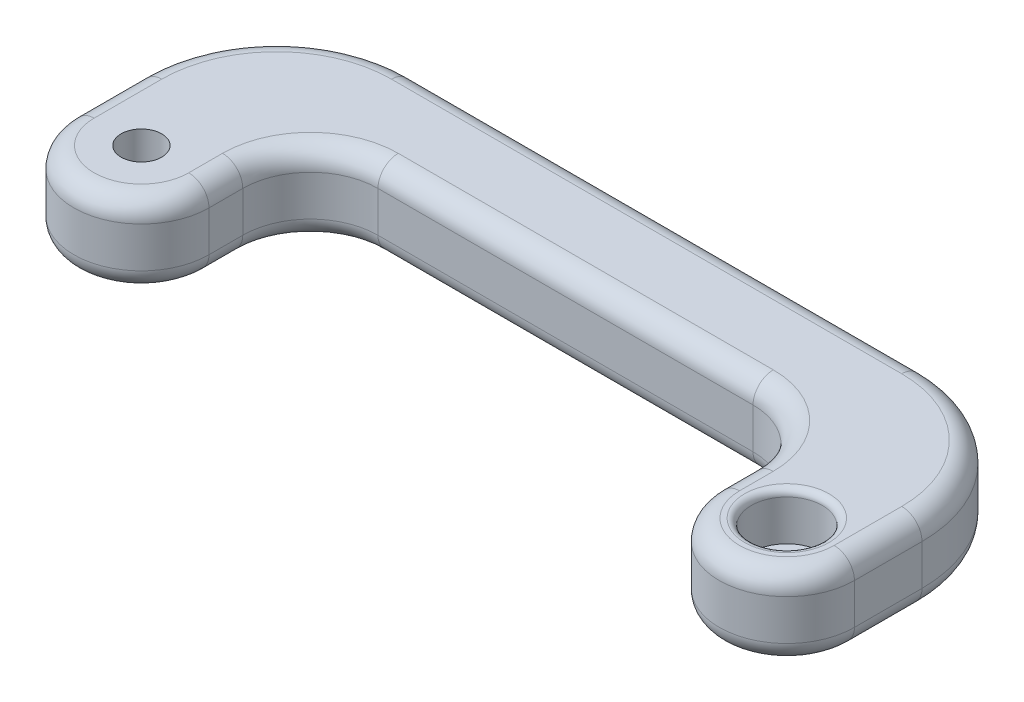
from build123d import *

# Parameters (mm, degrees)
SKETCH7_R           = 5
BOSS_EXTRUDE5_DEPTH = 12
FILLET2_R           = 20
FILLET3_R           = 10
FILLET5_R           = 3
SKETCH11_R          = 5.25
CUT_EXTRUDE1_DEPTH  = 36
FILLET6_R           = 1
SKETCH12_R          = 6.25
SKETCH12_R_2        = 3
BOSS_EXTRUDE6_DEPTH = 5
SKETCH13_R          = 6.25
SKETCH13_R_2        = 3
BOSS_EXTRUDE7_DEPTH = 5


with BuildPart() as part:
    # Sketch7 → Boss-Extrude5 (new body)
    with BuildSketch(Plane(origin=(0, 0, 0), x_dir=(1, 0, 0), z_dir=(0, 1, 0))):
        with BuildLine():
            Line((-105.5, 30), (-105.5, 0))
            ThreePointArc((-105.5, 0), (-95.5, -10), (-85.5, 0))
            Line((-85.5, 0), (-85.5, 15))
            Line((-85.5, 15), (-10, 15))
            Line((-10, 15), (-10, 0))
            ThreePointArc((-10, 0), (0, -10), (10, 0))
            Line((10, 0), (10, 30))
            Line((10, 30), (-10, 30))
            Line((-10, 30), (-85.5, 30))
            Line((-85.5, 30), (-105.5, 30))
        make_face()
        with Locations((-95.5, 0)):
            Circle(SKETCH7_R, mode=Mode.SUBTRACT)
    extrude(amount=BOSS_EXTRUDE5_DEPTH)

    # Fillet2
    fillet2_edges = [part.edges().sort_by_distance(p)[0] for p in [
        (10, 6, -30),
        (-105.5, 6, -30),
    ]]
    fillet(fillet2_edges, radius=FILLET2_R)

    # Fillet3
    fillet3_edges = [part.edges().sort_by_distance(p)[0] for p in [
        (-10, 6, -15),
        (-85.5, 6, -15),
    ]]
    fillet(fillet3_edges, radius=FILLET3_R)

    # Fillet5
    fillet5_edges = [part.edges().sort_by_distance(p)[0] for p in [
        (-47.75, 12, -30),
        (4.142135624, 12, -24.142135624),
        (10, 12, -5),
        (0, 12, 10),
        (-10, 12, -2.5),
        (-12.928932188, 12, -12.071067812),
        (-47.75, 12, -15),
        (-82.571067812, 12, -12.071067812),
        (-85.5, 12, -2.5),
        (-95.5, 12, 10),
        (-105.5, 12, -5),
        (-105.5, 0, -5),
        (-95.5, 0, 10),
        (-85.5, 0, -2.5),
        (-82.571067812, 0, -12.071067812),
        (-47.75, 0, -15),
        (-12.928932188, 0, -12.071067812),
        (-10, 0, -2.5),
        (0, 0, 10),
        (10, 0, -5),
        (4.142135624, 0, -24.142135624),
        (-47.75, 0, -30),
        (-99.642135624, 12, -24.142135624),
        (-99.642135624, 0, -24.142135624),
    ]]
    fillet(fillet5_edges, radius=FILLET5_R)

    # Sketch11 → Cut-Extrude1 (cut)
    with BuildSketch(Plane.XZ):
        with Locations((-95.5, 0)):
            Circle(SKETCH11_R)
        Circle(SKETCH11_R)
    extrude(amount=-CUT_EXTRUDE1_DEPTH, mode=Mode.SUBTRACT)

    # Fillet6
    fillet6_edges = [part.edges().sort_by_distance(p)[0] for p in [
        (-100.75, 12, 0),
        (-5.25, 12, 0),
        (-5.25, 0, 0),
        (-100.75, 0, 0),
    ]]
    fillet(fillet6_edges, radius=FILLET6_R)

    # Sketch12 → Boss-Extrude6 (add)
    with BuildSketch(Plane(origin=(0, 12, 0), x_dir=(1, 0, 0), z_dir=(0, 1, 0))):
        with Locations((-95.5, 0)):
            Circle(SKETCH12_R)
        with Locations((-95.5, 0)):
            Circle(SKETCH12_R_2, mode=Mode.SUBTRACT)
    extrude(amount=-BOSS_EXTRUDE6_DEPTH)

    # Sketch13 → Boss-Extrude7 (add)
    with BuildSketch(Plane.XZ):
        Circle(SKETCH13_R)
        Circle(SKETCH13_R_2, mode=Mode.SUBTRACT)
    extrude(amount=-BOSS_EXTRUDE7_DEPTH)


solid = part.part
